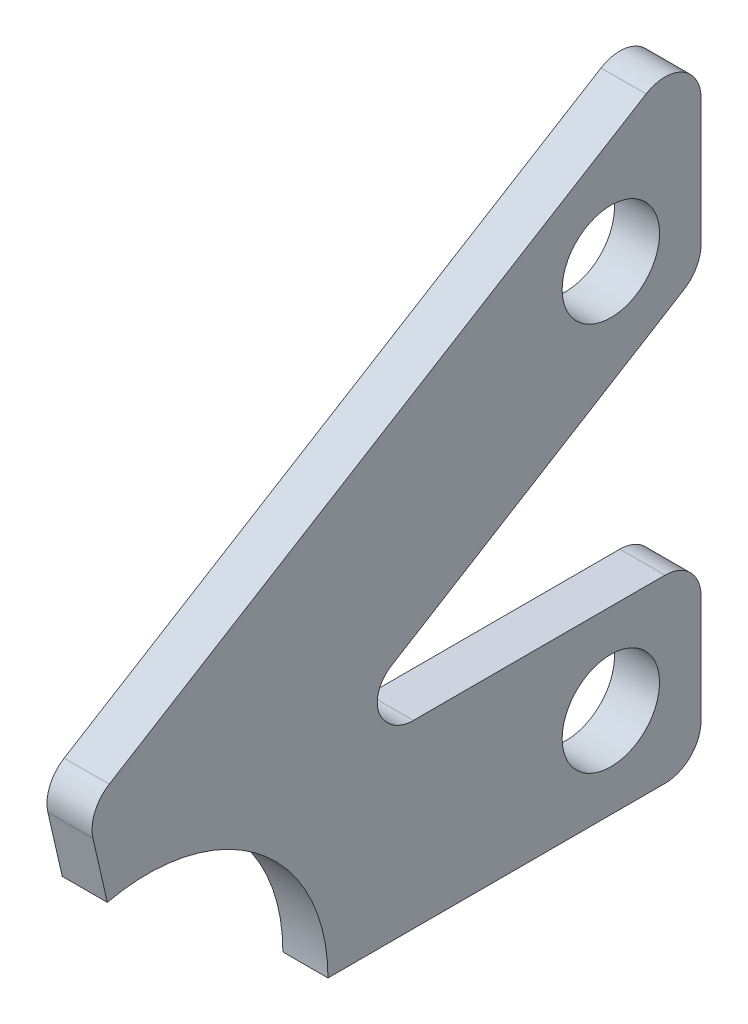
from build123d import *

# Parameters (mm, degrees)
SKETCH2_R           = 3.429
BOSS_EXTRUDE1_DEPTH = 3.175


with BuildPart() as part:
    # Sketch2 → Boss-Extrude1 (new body)
    with BuildSketch(Plane(origin=(-112.555, 0, -573.58969557), x_dir=(0, 0.6231241879767124, 0.7821229100073485), z_dir=(-1, 0, 0))):
        with BuildLine():
            Line((845.771780124, 136.999641403), (864.330586832, 122.213677187))
            ThreePointArc((864.330586832, 122.213677187), (874.263547789, 127), (884.196508746, 122.213677187))
            Line((884.196508746, 122.213677187), (887.735832346, 125.033487368))
            ThreePointArc((887.735832346, 125.033487368), (888.597587529, 126.330104481), (888.540958266, 127.885942216))
            Line((888.540958266, 127.885942216), (873.423706379, 169.576043207))
            ThreePointArc((873.423706379, 169.576043207), (871.446613669, 171.216745754), (869.04925283, 170.292915988))
            Line((869.04925283, 170.292915988), (863.47898249, 163.301314423))
            ThreePointArc((863.47898249, 163.301314423), (862.959009478, 162.129347633), (863.077713324, 160.852716328))
            Line((863.077713324, 160.852716328), (871.323924882, 138.111453883))
            ThreePointArc((871.323924882, 138.111453883), (871.188959814, 136.430204891), (869.830832527, 135.430052896))
            ThreePointArc((869.830832527, 135.430052896), (869.749583246, 135.412845003), (869.668400761, 135.39532469))
            ThreePointArc((869.668400761, 135.39532469), (868.550892206, 135.403510223), (867.545059791, 135.890535404))
            Line((867.545059791, 135.890535404), (853.685457311, 146.932602361))
            ThreePointArc((853.685457311, 146.932602361), (851.817152024, 147.46990594), (850.116129682, 146.528745607))
            Line((850.116129682, 146.528745607), (845.36792337, 140.568969032))
            ThreePointArc((845.36792337, 140.568969032), (844.830619791, 138.700663745), (845.771780124, 136.999641403))
        make_face()
        with Locations((852.708507005, 139.592018726)):
            Circle(SKETCH2_R, mode=Mode.SUBTRACT)
        with Locations((869.774365973, 161.012466745)):
            Circle(SKETCH2_R, mode=Mode.SUBTRACT)
    extrude(amount=BOSS_EXTRUDE1_DEPTH)


solid = part.part
